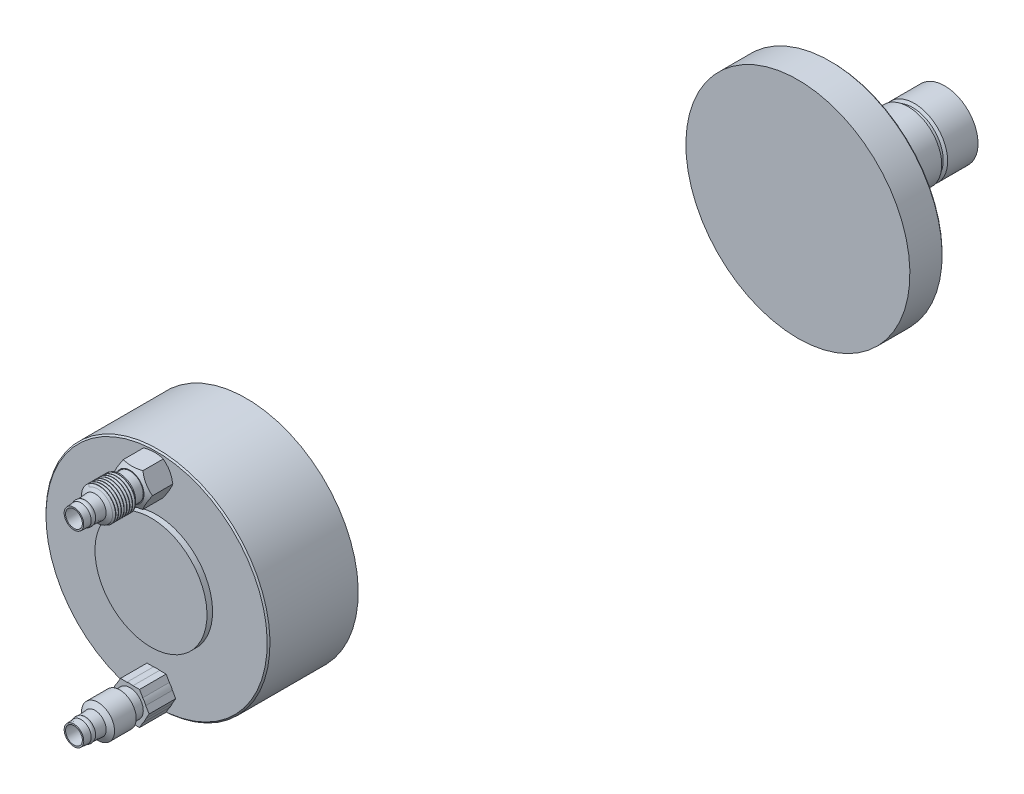
from build123d import *

# Parameters (mm, degrees)
EXTRUDE_1_DEPTH = 9.5
SWEEP_2_PITCH   = 1


with BuildPart() as part:
    # Эскиз2 → Повернуть2 (revolve)
    with BuildSketch(Plane(origin=(0, 0, 0), x_dir=(0, 0, -1), z_dir=(1, 0, 0)), mode=Mode.PRIVATE) as revolve_2_sk:
        with BuildLine():
            Line((-304, 33.5), (-282, 33.5))
            Line((-282, 33.5), (-282, 39.5))
            Line((-282, 39.5), (-291.5, 39.5))
            Line((-291.5, 39.5), (-291.5, 38.25))
            Line((-291.5, 38.25), (-294.5, 38.25))
            Line((-294.5, 38.25), (-295.16395281, 39.4))
            Line((-295.16395281, 39.4), (-302.903034489, 39.4))
            Line((-302.903034489, 39.4), (-304, 37.5))
            Line((-304, 37.5), (-307.503322263, 37.266445182))
            ThreePointArc((-307.503322263, 37.266445182), (-308.265028918, 37.41707272), (-309, 37.166666667))
            Line((-309, 37.166666667), (-311.5, 37))
            Line((-311.5, 37), (-311.5, 36.5))
            Line((-311.5, 36.5), (-304, 36.5))
            Line((-304, 36.5), (-304, 33.5))
        make_face()
    revolve(revolve_2_sk.sketch.rotate(Axis((0, 33.5, 304), (0, 0, -1)), 180), axis=Axis((0, 33.5, 304), (0, 0, -1)))



with BuildPart() as body_2:
    # Эскиз2<4> → Повернуть3 (revolve)
    with BuildSketch(Plane(origin=(0, 0, 0), x_dir=(0, 0, -1), z_dir=(1, 0, 0)), mode=Mode.PRIVATE) as revolve_3_sk:
        with BuildLine():
            Line((-304, -36.5), (-311.5, -36.5))
            Line((-311.5, -36.5), (-311.5, -37))
            Line((-311.5, -37), (-309, -37.166666667))
            ThreePointArc((-309, -37.166666667), (-308.265028918, -37.41707272), (-307.503322263, -37.266445182))
            Line((-307.503322263, -37.266445182), (-304, -37.5))
            Line((-304, -37.5), (-302.903034489, -39.4))
            Line((-302.903034489, -39.4), (-295.16395281, -39.4))
            Line((-295.16395281, -39.4), (-294.5, -38.25))
            Line((-294.5, -38.25), (-291.5, -38.25))
            Line((-291.5, -38.25), (-291.5, -39.5))
            Line((-291.5, -39.5), (-282, -39.5))
            Line((-282, -39.5), (-282, -33.5))
            Line((-282, -33.5), (-304, -33.5))
            Line((-304, -33.5), (-304, -36.5))
        make_face()
    revolve(revolve_3_sk.sketch.rotate(Axis((0, -33.5, 282), (0, 0, 1)), 180), axis=Axis((0, -33.5, 282), (0, 0, 1)))


with BuildPart() as body_3:
    # Эскиз2<5> → Повернуть4 (revolve)
    with BuildSketch(Plane(origin=(0, 0, 0), x_dir=(0, 0, -1), z_dir=(1, 0, 0)), mode=Mode.PRIVATE) as revolve_4_sk:
        Polygon((-284, 20), (-284, 0), (-250, 0), (-250, 40), (-281.5, 40), (-282, 39.5), (-282, 33.5), (-282, 20), align=None)
        Polygon((-53, 40), (-53, 0), (-41, 0), (-41, 39), (-41, 39.5), (-41.5, 40), align=None)
        Polygon((-26, 12), (-26, 0), (0, 0), (0, 10.9), (-0.577350269, 11.9), (-11.422649731, 11.9), (-12, 10.9), (-13, 10.9), (-13.635085296, 12), align=None)
    revolve(revolve_4_sk.sketch.rotate(Axis((0, 0, 317.567711928), (0, 0, -1)), 180), axis=Axis((0, 0, 317.567711928), (0, 0, -1)))


with BuildPart() as part_1:
    add(part.part)

    add(body_2.part)  # Бобышка-Вытянуть1 merges body 2
    # Эскиз4 → Бобышка-Вытянуть1 (add)
    with BuildSketch(Plane.XY.offset(282)):
        Polygon((3.464101615, 39.5), (-3.464101615, 39.5), (-6.92820323, 33.5), (-3.464101615, 27.5), (3.464101615, 27.5), (6.92820323, 33.5), align=None)
        Polygon((3.40959733, -27.6), (-3.40959733, -27.6), (-6.819194661, -33.505595809), (-3.40959733, -39.411191619), (3.40959733, -39.411191619), (6.819194661, -33.505595809), align=None)
    extrude(amount=EXTRUDE_1_DEPTH)

    # Эскиз5 → Вырез-Повернуть6 (revolve, cut)
    with BuildSketch(Plane(origin=(0, 0, 0), x_dir=(0, 0, -1), z_dir=(1, 0, 0)), mode=Mode.PRIVATE) as cut_revolve_6_sk:
        Polygon((-282, 48.5), (-291.5, 48.5), (-291.5, 38.5), (-286.75, 46.727241336), (-282, 38.5), align=None)
    revolve(cut_revolve_6_sk.sketch.rotate(Axis((0, 33.5, 282), (0, 0, 1)), 150.000000203), axis=Axis((0, 33.5, 282), (0, 0, 1)), mode=Mode.SUBTRACT)

    # Вырез-По траектории2: the profile of Эскиз10 screwed along a right-hand helix of 18 turns, 8 arcs to a turn; built about Z, then put on its axis
    sweep_2_z = Axis((0, 0, 0), (0, 0, 1))
    sweep_2_corners = [(6, 0, 0), (5.138304723, 0.013191957, -0.497325067), (6, 0.026383914, -0.994650134)]
    with BuildLine(mode=Mode.PRIVATE) as sweep_2_profile:
        Line(sweep_2_corners[0], sweep_2_corners[1])
        Line(sweep_2_corners[1], sweep_2_corners[2])
        Line(sweep_2_corners[2], sweep_2_corners[0])
    sweep_2_cap = Face(sweep_2_profile.wire())
    sweep_2_turn_angles = [0, 22.5, 45, 67.5, 90, 112.5, 135, 157.5, 180, 202.5, 225, 247.5, 270, 292.5, 315, 337.5, 360]
    sweep_2_turn_weights = [1, 0.9238795325112867, 1, 0.9238795325112867, 1, 0.9238795325112867, 1, 0.9238795325112867, 1, 0.9238795325112867, 1, 0.9238795325112867, 1, 0.9238795325112867, 1, 0.9238795325112867, 1]
    sweep_2_turn_rails = [Edge.make_bspline([Vector(p[0], p[1], 0).rotate(sweep_2_z, sweep_2_turn_angles[k]) / sweep_2_turn_weights[k] + Vector(0, 0, p[2] + SWEEP_2_PITCH * sweep_2_turn_angles[k] / 360) for k in range(17)], [0, 0, 0, 1, 1, 2, 2, 3, 3, 4, 4, 5, 5, 6, 6, 7, 7, 8, 8, 8], 2, sweep_2_turn_weights) for p in sweep_2_corners]
    sweep_2_turn_sides = [Face.make_surface_from_curves(sweep_2_turn_rails[p[0]], sweep_2_turn_rails[p[1]]) for p in [(0, 1), (1, 2), (2, 0)]]
    sweep_2 = Plane(origin=(0, 33.5, 311.5), x_dir=(1, 0, 0), z_dir=(0, 0, -1)) * Solid(Shell([*[p.moved(Location((0, 0, SWEEP_2_PITCH * i))) for i in range(18) for p in sweep_2_turn_sides], sweep_2_cap, sweep_2_cap.rotate(sweep_2_z, 6480).moved(Location((0, 0, SWEEP_2_PITCH * 6480 / 360)))]))
    add(sweep_2, mode=Mode.SUBTRACT)


solid = Compound([body_3.part, part_1.part])
